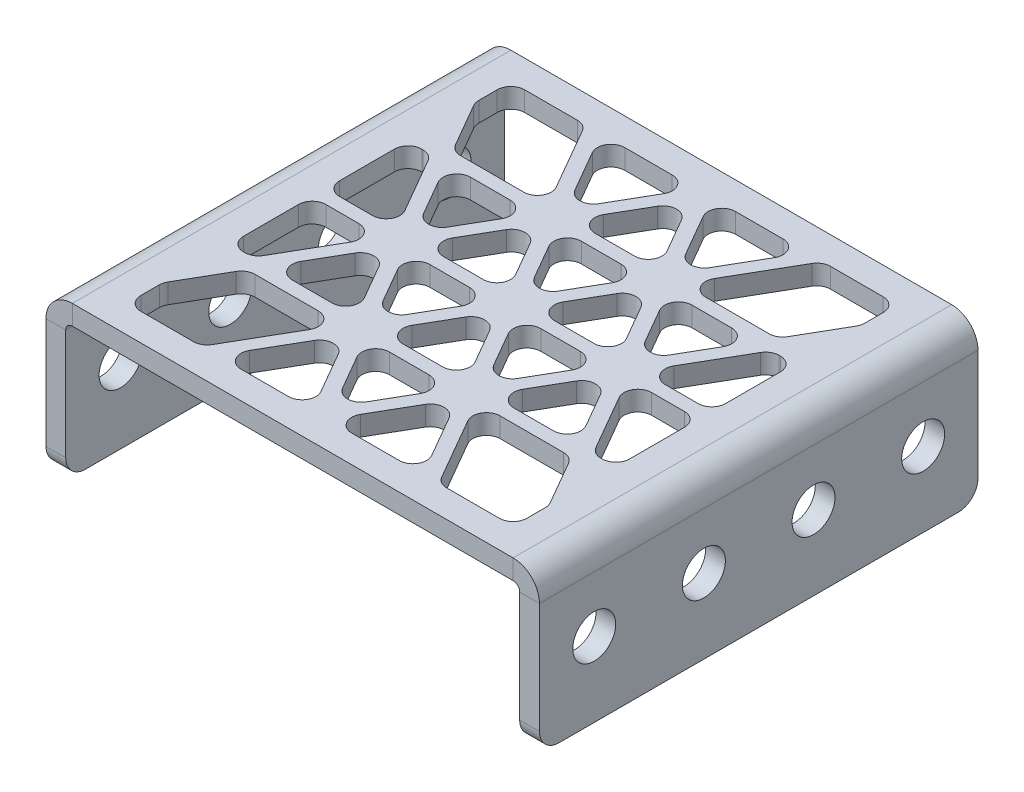
from build123d import *

# Parameters (mm, degrees)
BASE_FLANGE1_DEPTH      = 50.8
CUT_EXTRUDE1_DEPTH      = 60.175084092
CUT_EXTRUDE1_DEPTH_BACK = 60.175084092
SKETCH3_R               = 2.4892
CUT_EXTRUDE2_DEPTH      = 62.049099469
FILLET1_R               = 1.5875
FILLET2_R               = 2.286


# Sheet-metal steps are written as plain solids
with BuildPart() as part:
    # Sketch1 → Base-Flange1 (new body)
    with BuildSketch(Plane.XY):
        with BuildLine():
            Line((-26.289, -7.9375), (-26.289, 7.1755))
            ThreePointArc((-26.289, 7.1755), (-26.065815367, 7.714315367), (-25.527, 7.9375))
            Line((-25.527, 7.9375), (25.527, 7.9375))
            ThreePointArc((25.527, 7.9375), (26.065815367, 7.714315367), (26.289, 7.1755))
            Line((26.289, 7.1755), (26.289, -7.9375))
            Line((26.289, -7.9375), (28.575, -7.9375))
            Line((28.575, -7.9375), (28.575, 7.1755))
            ThreePointArc((28.575, 7.1755), (27.682261469, 9.330761469), (25.527, 10.2235))
            Line((25.527, 10.2235), (-25.527, 10.2235))
            ThreePointArc((-25.527, 10.2235), (-27.682261469, 9.330761469), (-28.575, 7.1755))
            Line((-28.575, 7.1755), (-28.575, -7.9375))
            Line((-28.575, -7.9375), (-26.289, -7.9375))
        make_face()
    extrude(amount=BASE_FLANGE1_DEPTH)

    # Sketch3 → Cut-Extrude1 (cut, two sides: drawn at the far end of the back side and taken through both)
    with BuildSketch(Plane(origin=(0, 0, 0), x_dir=(0, 0, -1), z_dir=(1, 0, 0)).offset(-CUT_EXTRUDE1_DEPTH_BACK)):
        with Locations((-6.35, 0.6985)):
            Circle(SKETCH3_R)
        with Locations((-19.05, 0.6985)):
            Circle(SKETCH3_R)
        with Locations((-31.75, 0.6985)):
            Circle(SKETCH3_R)
        with Locations((-44.45, 0.6985)):
            Circle(SKETCH3_R)
    extrude(amount=CUT_EXTRUDE1_DEPTH + CUT_EXTRUDE1_DEPTH_BACK, mode=Mode.SUBTRACT)

    # Sketch4 → Cut-Extrude2 (cut, through all)
    with BuildSketch(Plane(origin=(0, 10.2235, 0), x_dir=(1, 0, 0), z_dir=(0, 1, 0))):
        Polygon((22.352, -47.625), (22.352, -43.477299651), (18.789142823, -37.30625), (7.790620195, -37.30625), (13.748153285, -47.625), align=None)
        Polygon((7.790620195, -35.71875), (17.872599271, -35.71875), (12.831609733, -26.9875), align=None)
        Polygon((14.206425061, -26.19375), (19.705686375, -35.71875), (22.352, -35.71875), (22.352, -26.19375), align=None)
        Polygon((0.916543552, -47.625), (11.91506618, -47.625), (6.415804866, -38.1), align=None)
        Polygon((0, -46.0375), (5.040989538, -37.30625), (-5.040989538, -37.30625), align=None)
        Polygon((-11.91506618, -47.625), (-0.916543552, -47.625), (-6.415804866, -38.1), align=None)
        Polygon((-22.352, -47.625), (-13.748153285, -47.625), (-7.790620195, -37.30625), (-18.789142823, -37.30625), (-22.352, -43.477299651), align=None)
        Polygon((-17.872599271, -35.71875), (-7.790620195, -35.71875), (-12.831609733, -26.9875), align=None)
        Polygon((-22.352, -35.71875), (-19.705686375, -35.71875), (-14.206425061, -26.19375), (-22.352, -26.19375), align=None)
        Polygon((-6.415804866, -34.925), (-1.374815329, -26.19375), (-11.456794404, -26.19375), align=None)
        Polygon((-5.040989538, -35.71875), (5.040989538, -35.71875), (0, -26.9875), align=None)
        Polygon((6.415804866, -34.925), (11.456794404, -26.19375), (1.374815329, -26.19375), align=None)
        Polygon((1.374815329, -24.60625), (11.456794404, -24.60625), (6.415804866, -15.875), align=None)
        Polygon((7.790620195, -15.08125), (12.831609733, -23.8125), (17.872599271, -15.08125), align=None)
        Polygon((14.206425061, -24.60625), (22.352, -24.60625), (22.352, -15.08125), (19.705686375, -15.08125), align=None)
        Polygon((-11.456794404, -24.60625), (-1.374815329, -24.60625), (-6.415804866, -15.875), align=None)
        Polygon((-22.352, -24.60625), (-14.206425061, -24.60625), (-19.705686375, -15.08125), (-22.352, -15.08125), align=None)
        Polygon((-12.831609733, -23.8125), (-7.790620195, -15.08125), (-17.872599271, -15.08125), align=None)
        Polygon((-7.790620195, -13.49375), (-13.748153285, -3.175), (-22.352, -3.175), (-22.352, -7.322700349), (-21.664592336, -8.513325349), (-18.789142823, -13.49375), align=None)
        Polygon((-6.415804866, -12.7), (-0.916543552, -3.175), (-11.91506618, -3.175), align=None)
        Polygon((-5.040989538, -13.49375), (5.040989538, -13.49375), (0, -4.7625), align=None)
        Polygon((0, -23.8125), (5.040989538, -15.08125), (-5.040989538, -15.08125), align=None)
        Polygon((0.916543552, -3.175), (6.415804866, -12.7), (11.91506618, -3.175), align=None)
        Polygon((7.790620195, -13.49375), (18.789142823, -13.49375), (21.664592336, -8.513325349), (22.352, -7.322700349), (22.352, -3.175), (13.748153285, -3.175), align=None)
    extrude(amount=-CUT_EXTRUDE2_DEPTH, mode=Mode.SUBTRACT)

    # Fillet1
    fillet1_edges = [part.edges().sort_by_distance(p)[0] for p in [
        (1.374815329, 9.0805, 24.60625),
        (6.415804866, 9.0805, 15.875),
        (11.456794404, 9.0805, 24.60625),
        (6.415804866, 9.0805, 34.925),
        (1.374815329, 9.0805, 26.19375),
        (11.456794404, 9.0805, 26.19375),
        (-6.415804866, 9.0805, 34.925),
        (-11.456794404, 9.0805, 26.19375),
        (-1.374815329, 9.0805, 26.19375),
        (-5.040989538, 9.0805, 35.71875),
        (0, 9.0805, 26.9875),
        (5.040989538, 9.0805, 35.71875),
        (14.206425061, 9.0805, 24.60625),
        (19.705686375, 9.0805, 15.08125),
        (22.352, 9.0805, 15.08125),
        (22.352, 9.0805, 24.60625),
        (12.831609733, 9.0805, 23.8125),
        (7.790620195, 9.0805, 15.08125),
        (17.872599271, 9.0805, 15.08125),
        (-11.456794404, 9.0805, 24.60625),
        (-6.415804866, 9.0805, 15.875),
        (-1.374815329, 9.0805, 24.60625),
        (-14.206425061, 9.0805, 24.60625),
        (-22.352, 9.0805, 24.60625),
        (-22.352, 9.0805, 15.08125),
        (-19.705686375, 9.0805, 15.08125),
        (19.705686375, 9.0805, 35.71875),
        (14.206425061, 9.0805, 26.19375),
        (22.352, 9.0805, 26.19375),
        (22.352, 9.0805, 35.71875),
        (7.790620195, 9.0805, 35.71875),
        (12.831609733, 9.0805, 26.9875),
        (17.872599271, 9.0805, 35.71875),
        (0, 9.0805, 46.0375),
        (-5.040989538, 9.0805, 37.30625),
        (5.040989538, 9.0805, 37.30625),
        (11.91506618, 9.0805, 47.625),
        (0.916543552, 9.0805, 47.625),
        (6.415804866, 9.0805, 38.1),
        (-13.748153285, 9.0805, 47.625),
        (-22.352, 9.0805, 47.625),
        (-22.352, 9.0805, 43.477299651),
        (-18.789142823, 9.0805, 37.30625),
        (-7.790620195, 9.0805, 37.30625),
        (-0.916543552, 9.0805, 47.625),
        (-11.91506618, 9.0805, 47.625),
        (-6.415804866, 9.0805, 38.1),
        (-22.352, 9.0805, 35.71875),
        (-22.352, 9.0805, 26.19375),
        (-14.206425061, 9.0805, 26.19375),
        (-19.705686375, 9.0805, 35.71875),
        (-17.872599271, 9.0805, 35.71875),
        (-12.831609733, 9.0805, 26.9875),
        (-7.790620195, 9.0805, 35.71875),
        (0, 9.0805, 23.8125),
        (-5.040989538, 9.0805, 15.08125),
        (5.040989538, 9.0805, 15.08125),
        (6.415804866, 9.0805, 12.7),
        (0.916543552, 9.0805, 3.175),
        (11.91506618, 9.0805, 3.175),
        (22.352, 9.0805, 7.322700349),
        (18.789142823, 9.0805, 13.49375),
        (7.790620195, 9.0805, 13.49375),
        (13.748153285, 9.0805, 3.175),
        (22.352, 9.0805, 3.175),
        (-12.831609733, 9.0805, 23.8125),
        (-17.872599271, 9.0805, 15.08125),
        (-7.790620195, 9.0805, 15.08125),
        (-18.789142823, 9.0805, 13.49375),
        (-22.352, 9.0805, 7.322700349),
        (-22.352, 9.0805, 3.175),
        (-13.748153285, 9.0805, 3.175),
        (-7.790620195, 9.0805, 13.49375),
        (-5.040989538, 9.0805, 13.49375),
        (0, 9.0805, 4.7625),
        (5.040989538, 9.0805, 13.49375),
        (-6.415804866, 9.0805, 12.7),
        (-11.91506618, 9.0805, 3.175),
        (-0.916543552, 9.0805, 3.175),
        (22.352, 9.0805, 43.477299651),
        (22.352, 9.0805, 47.625),
        (13.748153285, 9.0805, 47.625),
        (7.790620195, 9.0805, 37.30625),
        (18.789142823, 9.0805, 37.30625),
    ]]
    fillet(fillet1_edges, radius=FILLET1_R)

    # Fillet2
    fillet2_edges = [part.edges().sort_by_distance(p)[0] for p in [
        (27.432, -7.9375, 0),
        (-27.432, -7.9375, 0),
        (27.432, -7.9375, 50.8),
        (-27.432, -7.9375, 50.8),
    ]]
    fillet(fillet2_edges, radius=FILLET2_R)


solid = part.part
